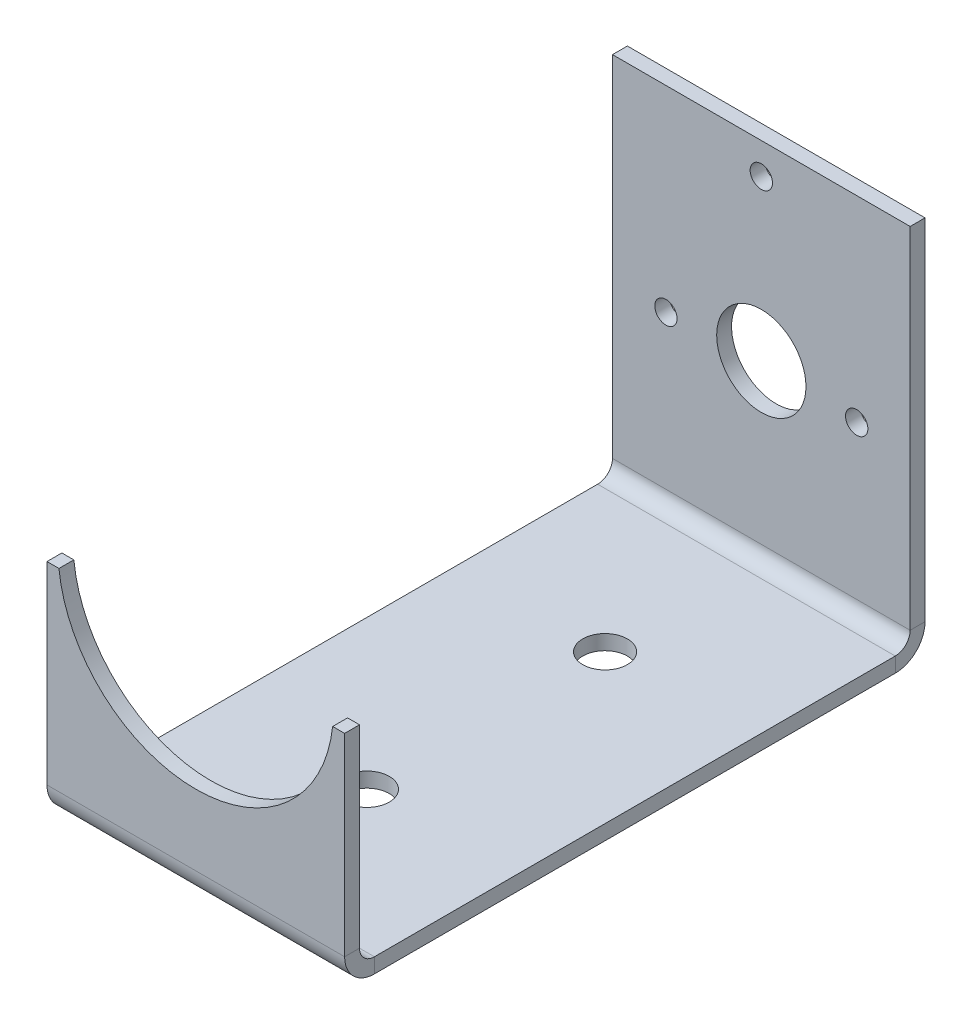
from build123d import *

# Parameters (mm, degrees)
SKETCH44_W          = 40
SKETCH44_H          = 70
BOSS_EXTRUDE1_DEPTH = 2
EDGE_FLANGE6_DEPTH  = 40
SKETCH52_R          = 6
SKETCH52_R_2        = 1.5
CUT_EXTRUDE5_DEPTH  = 25
SKETCH54_R          = 3
CUT_EXTRUDE6_DEPTH  = 11
EDGE_FLANGE7_DEPTH  = 40
CUT_EXTRUDE8_START  = -10
SKETCH52_4_R        = 18.5
CUT_EXTRUDE8_DEPTH  = 84


# Sheet-metal steps are written as plain solids
with BuildPart() as part:
    # Sketch44 → Boss-Extrude1 (new body)
    with BuildSketch(Plane(origin=(0, 0, 0), x_dir=(1, 0, 0), z_dir=(0, 1, 0))):
        Rectangle(SKETCH44_W, SKETCH44_H)
    extrude(amount=BOSS_EXTRUDE1_DEPTH)

    # Edge-Flange6 section (across the edge) → Edge-Flange6 (add)
    with BuildSketch(Plane(origin=(20, 2, -37), x_dir=(0, 0, 1), z_dir=(-1, 0, 0))):
        with BuildLine():
            Line((-2, 2), (-2, 49))
            Line((-2, 49), (0, 49))
            Line((0, 49), (0, 2))
            ThreePointArc((0, 2), (0.585786438, 0.585786438), (2, 0))
            Line((2, 0), (2, -2))
            ThreePointArc((2, -2), (-0.828427125, -0.828427125), (-2, 2))
        make_face()
    extrude(amount=EDGE_FLANGE6_DEPTH)

    # Sketch52 → Cut-Extrude5 (cut)
    with BuildSketch(Plane(origin=(0, 0, -39), x_dir=(-1, 0, 0), z_dir=(0, 0, -1))):
        with Locations(Location((0, 25.347000811, 0), (0, 0, 90))):
            Circle(SKETCH52_R)
        with Locations(Location((0, 46.800736891, 0), (0, 0, 90))):
            Circle(SKETCH52_R_2)
        with Locations(Location((-12.817814142, 24.599631554, 0), (0, 0, 90))):
            Circle(SKETCH52_R_2)
        with Locations(Location((12.817814142, 24.599631554, 0), (0, 0, 90))):
            Circle(SKETCH52_R_2)
    extrude(amount=-CUT_EXTRUDE5_DEPTH, mode=Mode.SUBTRACT)

    # Sketch54 → Cut-Extrude6 (cut)
    with BuildSketch(Plane(origin=(0, 2, 0), x_dir=(1, 0, 0), z_dir=(0, 1, 0))):
        with Locations(Location((0, 16, 0), (0, 0, 270))):
            Circle(SKETCH54_R)
        with Locations(Location((0, -16, 0), (0, 0, 270))):
            Circle(SKETCH54_R)
    extrude(amount=-CUT_EXTRUDE6_DEPTH, mode=Mode.SUBTRACT)

    # Edge-Flange7 section (across the edge) → Edge-Flange7 (add)
    with BuildSketch(Plane(origin=(-20, 2, 37), x_dir=(0, 0, -1), z_dir=(1, 0, 0))):
        with BuildLine():
            Line((-2, 2), (-2, 28))
            Line((-2, 28), (0, 28))
            Line((0, 28), (0, 2))
            ThreePointArc((0, 2), (0.585786438, 0.585786438), (2, 0))
            Line((2, 0), (2, -2))
            ThreePointArc((2, -2), (-0.828427125, -0.828427125), (-2, 2))
        make_face()
    extrude(amount=EDGE_FLANGE7_DEPTH)

    # Sketch52<4> → Cut-Extrude8 (cut)
    with BuildSketch(Plane(origin=(0, 0, -39), x_dir=(-1, 0, 0), z_dir=(0, 0, -1)).offset(CUT_EXTRUDE8_START)):
        with Locations((0, 32)):
            Circle(SKETCH52_4_R)
    extrude(amount=-CUT_EXTRUDE8_DEPTH, mode=Mode.SUBTRACT)


solid = part.part
